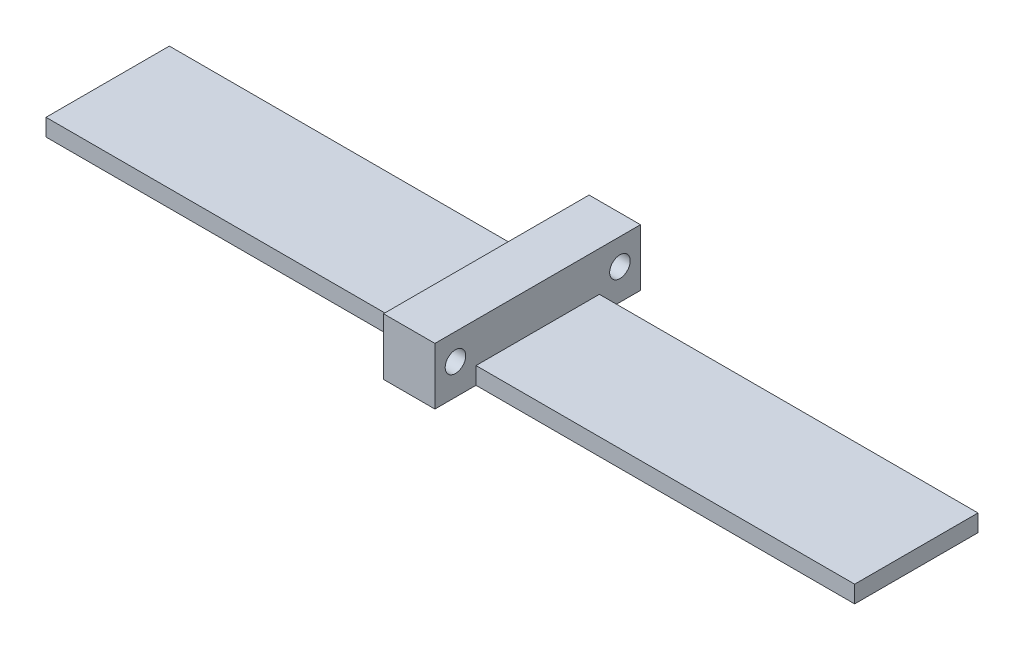
from build123d import *

# Parameters (mm, degrees)
SKETCH1_W            = 299.72
SKETCH1_H            = 45.72
SPRING_PLATE_DEPTH   = 6.35
SKETCH2_W            = 19.05
SKETCH2_H            = 76.2
SLOT_TAB_DEPTH       = 21.082
SPLIT1_START         = 6.35
SPLIT1_OUTLINE_W     = 19.05
SPLIT1_OUTLINE_H     = 76.2
SPLIT1_DEPTH         = 14.732
SPLIT1_2_OUTLINE_W   = 19.05
SPLIT1_2_OUTLINE_H   = 15.24
SPLIT1_2_DEPTH       = 6.35
SPLIT1_3_OUTLINE_W   = 19.05
SPLIT1_3_OUTLINE_H   = 76.2
SPLIT1_3_DEPTH       = 14.732
SPLIT1_4_OUTLINE_W   = 19.05
SPLIT1_4_OUTLINE_H   = 15.24
SPLIT1_4_DEPTH       = 6.35
ROD_SLOTS_DEPTH      = 19.05
ROD_SLOTS_DEPTH_BACK = 14.732
SKETCH3_R            = 3.81


# Read off the part's stored shape, not the designer's step: Split1
with BuildPart() as part:
    # Sketch1 → Spring Plate (new body)
    with BuildSketch(Plane(origin=(0, 0, 0), x_dir=(1, 0, 0), z_dir=(0, 1, 0))):
        Rectangle(SKETCH1_W, SKETCH1_H)
    extrude(amount=SPRING_PLATE_DEPTH)

    # Sketch2 → Slot Tab (add)
    with BuildSketch(Plane(origin=(0, 0, 0), x_dir=(1, 0, 0), z_dir=(0, 1, 0))):
        Rectangle(SKETCH2_W, SKETCH2_H)
    extrude(amount=SLOT_TAB_DEPTH)

    # Split1 outline → Split1 (cut)
    with BuildSketch(Plane(origin=(0, 0, 0), x_dir=(1, 0, 0), z_dir=(0, 1, 0)).offset(SPLIT1_START)):
        Rectangle(SPLIT1_OUTLINE_W, SPLIT1_OUTLINE_H)
    extrude(amount=SPLIT1_DEPTH, mode=Mode.SUBTRACT)

    # Split1 2 outline → Split1 2 (cut)
    with BuildSketch(Plane(origin=(0, 0, 0), x_dir=(1, 0, 0), z_dir=(0, 1, 0))):
        with Locations((0, -30.48)):
            Rectangle(SPLIT1_2_OUTLINE_W, SPLIT1_2_OUTLINE_H)
        with Locations((0, 30.48)):
            Rectangle(SPLIT1_2_OUTLINE_W, SPLIT1_2_OUTLINE_H)
    extrude(amount=SPLIT1_2_DEPTH, mode=Mode.SUBTRACT)


with BuildPart() as body_2:
    # Split1 3 outline → Split1 3 (new body)
    with BuildSketch(Plane(origin=(0, 0, 0), x_dir=(1, 0, 0), z_dir=(0, 1, 0)).offset(SPLIT1_START)):
        Rectangle(SPLIT1_3_OUTLINE_W, SPLIT1_3_OUTLINE_H)
    extrude(amount=SPLIT1_3_DEPTH)

    # Split1 4 outline → Split1 4 (add)
    with BuildSketch(Plane(origin=(0, 0, 0), x_dir=(1, 0, 0), z_dir=(0, 1, 0))):
        with Locations((0, -30.48)):
            Rectangle(SPLIT1_4_OUTLINE_W, SPLIT1_4_OUTLINE_H)
        with Locations((0, 30.48)):
            Rectangle(SPLIT1_4_OUTLINE_W, SPLIT1_4_OUTLINE_H)
    extrude(amount=SPLIT1_4_DEPTH)

    # Sketch3 → Rod Slots (cut, two sides: drawn at the far end of the back side and taken through both)
    with BuildSketch(Plane(origin=(0, 0, 0), x_dir=(0, 0, -1), z_dir=(1, 0, 0)).offset(-ROD_SLOTS_DEPTH_BACK)):
        with Locations(Location((-30.48, 11.43, 0), (0, 0, 180))):
            Circle(SKETCH3_R)
        with Locations(Location((30.48, 11.43, 0), (0, 0, 180))):
            Circle(SKETCH3_R)
    extrude(amount=ROD_SLOTS_DEPTH + ROD_SLOTS_DEPTH_BACK, mode=Mode.SUBTRACT)


solid = Compound([part.part, body_2.part])
